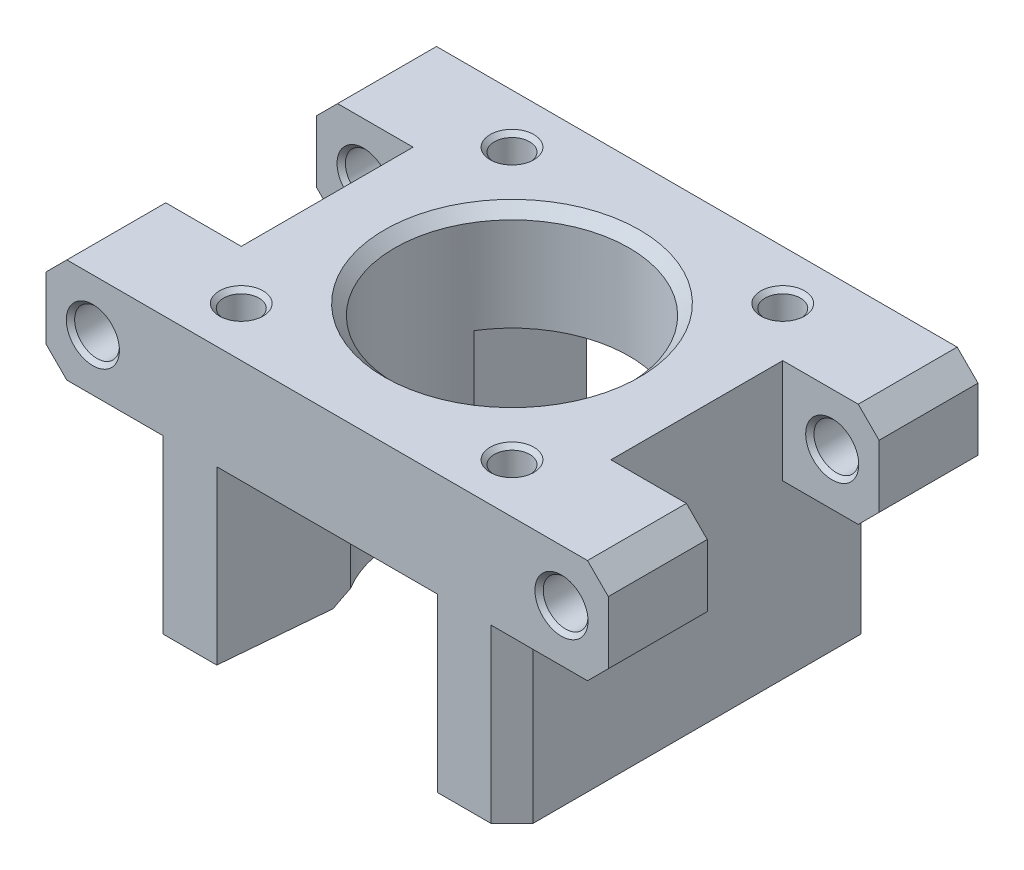
from build123d import *

# Parameters (mm, degrees)
BOSS_EXTRUDE1_DEPTH  = 35.5
SKETCH2_R            = 2.15
CUT_EXTRUDE1_DEPTH   = 35.5
SKETCH3_R            = 11.25
CUT_EXTRUDE2_DEPTH   = 35.5
M3_CLEARANCE_HOLE1_D = 3.4
SKETCH8_W            = 19
SKETCH8_H            = 35.5
CUT_EXTRUDE3_DEPTH   = 16.5
CHAMFER1_SIZE        = 1.1
CHAMFER1_SIZE_2      = 12.573057533
SKETCH9_W            = 9.25
SKETCH9_H            = 16.5
CUT_EXTRUDE4_DEPTH   = 10
CHAMFER4_SIZE        = 2
CHAMFER6_SIZE        = 1
CHAMFER7_SIZE        = 0.4
CHAMFER8_SIZE        = 2


with BuildPart() as part:
    # Sketch1 → Boss-Extrude1 (new body)
    with BuildSketch(Plane.XY):
        Polygon((0, 0), (0, -10), (9.25, -10), (9.25, -26.5), (44.75, -26.5), (44.75, -10), (54, -10), (54, 0), align=None)
    extrude(amount=BOSS_EXTRUDE1_DEPTH)

    # Sketch2 → Cut-Extrude1 (cut)
    with BuildSketch(Plane.XY.offset(35.5)):
        with Locations((4.5, -5)):
            Circle(SKETCH2_R)
        with Locations((49.5, -5)):
            Circle(SKETCH2_R)
    extrude(amount=-CUT_EXTRUDE1_DEPTH, mode=Mode.SUBTRACT)

    # Sketch3 → Cut-Extrude2 (cut)
    with BuildSketch(Plane.XZ.offset(26.5)):
        with Locations((27, 17.75)):
            Circle(SKETCH3_R)
    extrude(amount=-CUT_EXTRUDE2_DEPTH, mode=Mode.SUBTRACT)

    # M3 Clearance Hole1 (through all)
    with Locations(Plane(origin=(0, -26.5, 0), x_dir=(-1, 0, 0), z_dir=(0, -1, 0))):
        with Locations((-14, -30.75), (-40, -30.75), (-40, -4.75), (-14, -4.75)):
            Hole(M3_CLEARANCE_HOLE1_D / 2)

    # Sketch8 → Cut-Extrude3 (cut)
    with BuildSketch(Plane.XZ.offset(26.5)):
        with Locations((27, 17.75)):
            Rectangle(SKETCH8_W, SKETCH8_H)
    extrude(amount=-CUT_EXTRUDE3_DEPTH, mode=Mode.SUBTRACT)

    # Chamfer1
    # the kernel refuses this chamfer: 12.573057533, 1.1 mm, written as the material it takes off along each edge
    with BuildSketch(Plane(origin=(36.5, -59.185348851, 0), x_dir=(0.9159861691531063, 0, -0.40120984275091887), z_dir=(0, 1, 0)), Plane(origin=(17.5, -59.185348851, 35.5), x_dir=(-0.9159861691531072, 0, 0.40120984275091703), z_dir=(0, 1, 0))) as chamfer1_piece_1:
        Polygon((CHAMFER1_SIZE * 0.915986169153, -CHAMFER1_SIZE * 0.401209842751), (-CHAMFER1_SIZE_2 * 0.401209842752, -CHAMFER1_SIZE_2 * 0.915986169156), (0, 0), align=None)
    extrude(amount=49.185348851, mode=Mode.SUBTRACT)
    with BuildSketch(Plane(origin=(17.5, -59.185348851, 0), x_dir=(-0.9159861691531066, 0, -0.4012098427509178), z_dir=(0, 1, 0)), Plane(origin=(36.5, -59.185348851, 35.5), x_dir=(0.9159861691531066, 0, 0.40120984275091803), z_dir=(0, 1, 0))) as chamfer1_piece_2:
        Polygon((CHAMFER1_SIZE * 0.915986169153, CHAMFER1_SIZE * 0.401209842751), (-CHAMFER1_SIZE_2 * 0.401209842752, CHAMFER1_SIZE_2 * 0.915986169156), (0, 0), align=None)
    extrude(amount=49.185348851, mode=Mode.SUBTRACT)

    # Sketch9 → Cut-Extrude4 (cut)
    with BuildSketch(Plane(origin=(0, 0, 0), x_dir=(1, 0, 0), z_dir=(0, 1, 0))):
        with Locations((4.625, -17.75)):
            Rectangle(SKETCH9_W, SKETCH9_H)
        with Locations((49.375, -17.75)):
            Rectangle(SKETCH9_W, SKETCH9_H)
    extrude(amount=-CUT_EXTRUDE4_DEPTH, mode=Mode.SUBTRACT)

    # Chamfer4
    chamfer4_edges = [part.edges().sort_by_distance(p)[0] for p in [
        (54, 0, 30.75),
        (54, -10, 30.75),
        (0, -10, 30.75),
        (0, 0, 30.75),
        (54, 0, 4.75),
        (54, -10, 4.75),
        (0, -10, 4.75),
        (0, 0, 4.75),
    ]]
    chamfer(chamfer4_edges, length=CHAMFER4_SIZE)

    # Chamfer6
    chamfer6_edges = [part.edges().sort_by_distance(p)[0] for p in [
        (15.75, 0, 17.75),
        (37.820600651, -26.5, 14.67150986),
        (15.75, -26.5, 17.75),
    ]]
    chamfer(chamfer6_edges, length=CHAMFER6_SIZE)

    # Chamfer7
    chamfer7_edges = [part.edges().sort_by_distance(p)[0] for p in [
        (2.35, -5, 9.5),
        (2.35, -5, 26),
        (47.35, -5, 26),
        (47.35, -5, 9.5),
        (2.35, -5, 0),
        (2.35, -5, 35.5),
        (47.35, -5, 0),
        (47.35, -5, 35.5),
        (12.3, -26.5, 4.75),
        (12.3, 0, 4.75),
        (38.3, -26.5, 4.75),
        (38.3, 0, 4.75),
        (38.3, -26.5, 30.75),
        (38.3, 0, 30.75),
        (12.3, -26.5, 30.75),
        (12.3, 0, 30.75),
    ]]
    chamfer(chamfer7_edges, length=CHAMFER7_SIZE)

    # Chamfer8
    chamfer8_edges = [part.edges().sort_by_distance(p)[0] for p in [
        (9.25, -18.25, 35.5),
        (44.75, -18.25, 35.5),
        (44.75, -18.25, 0),
        (9.25, -18.25, 0),
    ]]
    chamfer(chamfer8_edges, length=CHAMFER8_SIZE)


solid = part.part
